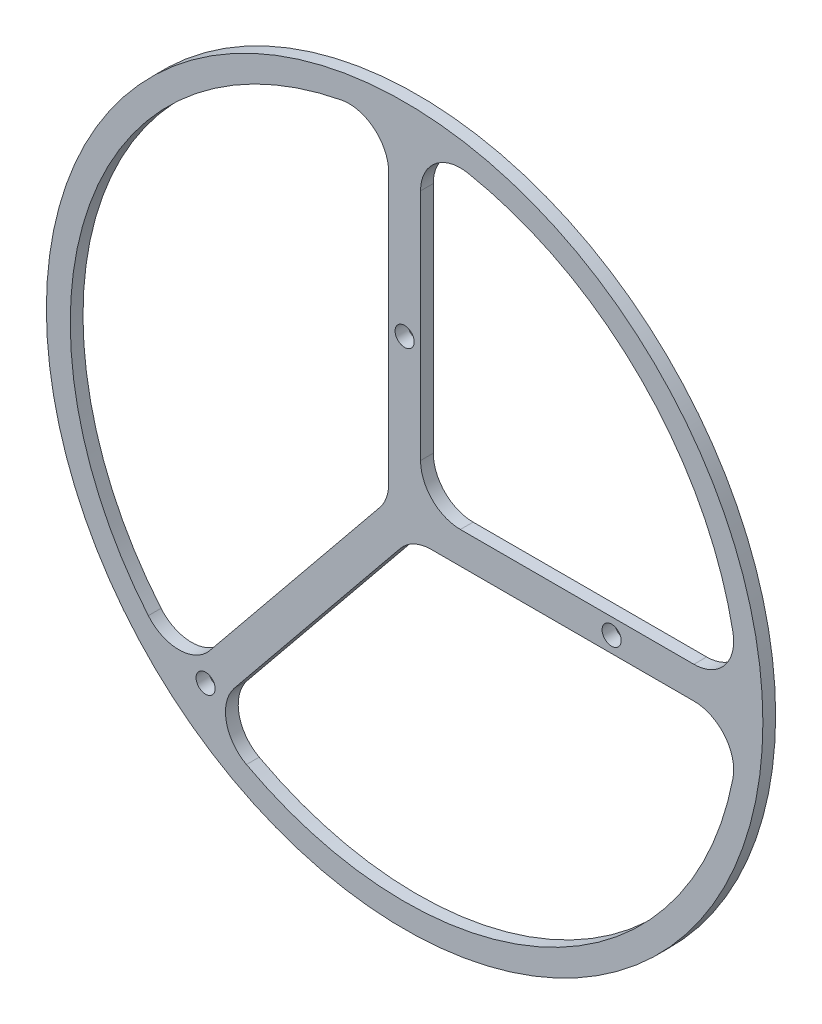
from build123d import *

# Parameters (mm, degrees)
SKETCH5_R                = 45
BOSS_EXTRUDE2_DEPTH      = 1.6
M2_CLEARANCE_HOLE2_D     = 2.4
M2_CLEARANCE_HOLE2_DEPTH = 1.6
M2_CLEARANCE_HOLE2_TIP   = 0.721032743
CUT_EXTRUDE1_DEPTH       = 64.659720389
FILLET1_R                = 5


with BuildPart() as part:
    # Sketch5 → Boss-Extrude2 (new body)
    with BuildSketch(Plane(origin=(0, 0, 0), x_dir=(0, 1, 0), z_dir=(0, 0, 1))):
        Circle(SKETCH5_R)
    extrude(amount=BOSS_EXTRUDE2_DEPTH)

    # M2 Clearance Hole2
    with Locations(Plane.YX):
        with Locations((-30.721475067, -25), (-39.5, 26), (0, 26), (19.5, 0)):
            Hole(M2_CLEARANCE_HOLE2_D / 2, depth=M2_CLEARANCE_HOLE2_DEPTH)
            with Locations((0, 0, -(M2_CLEARANCE_HOLE2_DEPTH + M2_CLEARANCE_HOLE2_TIP / 2))):  # 118° drill point
                Cone(0, M2_CLEARANCE_HOLE2_D / 2, M2_CLEARANCE_HOLE2_TIP, mode=Mode.SUBTRACT)

    # Sketch8 → Cut-Extrude1 (cut, through all)
    with BuildSketch(Plane.XY.offset(1.6)):
        with BuildLine():
            Line((-28.030861465, -31.277320946), (-2, 0.710937513))
            Line((-2, 0.710937513), (-2, 41.952353927))
            ThreePointArc((-2, 41.952353927), (-39.574101134, 14.067356519), (-28.030861465, -31.277320946))
        make_face()
        with BuildLine():
            Line((0.951008631, -2), (-24.928324138, -33.802051057))
            ThreePointArc((-24.928324138, -33.802051057), (18.035992083, -37.930238459), (41.952353927, -2))
            Line((41.952353927, -2), (0.951008631, -2))
        make_face()
        with BuildLine():
            ThreePointArc((41.952353927, 2), (29.69848481, 29.69848481), (2, 41.952353927))
            Line((2, 41.952353927), (2, 2))
            Line((2, 2), (41.952353927, 2))
        make_face()
    extrude(amount=-CUT_EXTRUDE1_DEPTH, mode=Mode.SUBTRACT)

    # Fillet1
    fillet1_edges = [part.edges().sort_by_distance(p)[0] for p in [
        (-24.928324138, -33.802051057, 0.8),
        (-28.030861465, -31.277320946, 0.8),
        (-2, 0.710937513, 0.8),
        (2, 2, 0.8),
        (0.951008631, -2, 0.8),
        (41.952353927, -2, 0.8),
        (41.952353927, 2, 0.8),
        (-2, 41.952353927, 0.8),
        (2, 41.952353927, 0.8),
    ]]
    fillet(fillet1_edges, radius=FILLET1_R)


solid = part.part
